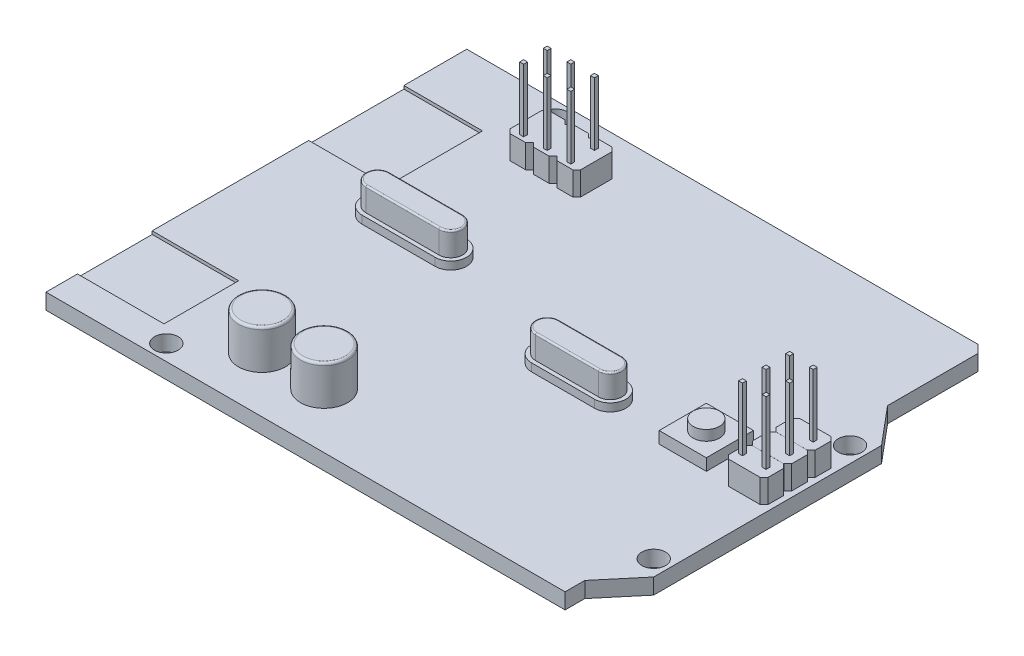
from build123d import *

# Parameters (mm, degrees)
BOSS_EXTRUDE1_DEPTH  = 2
SKETCH2_R            = 1.5
CUT_EXTRUDE1_DEPTH   = 89.126329777
SKETCH3_W            = 11
SKETCH3_H            = 9.5
SKETCH3_W_2          = 10
SKETCH3_H_2          = 12.1
CUT_EXTRUDE3_DEPTH   = 0.4
BOSS_EXTRUDE4_DEPTH  = 3
LPATTERN2_COUNT      = 3
LPATTERN2_PITCH      = 3
SKETCH7_W            = 0.5
SKETCH7_H            = 0.5
BOSS_EXTRUDE6_DEPTH  = 8
LPATTERN3_COUNT      = 3
LPATTERN3_PITCH      = 3
LPATTERN3_COUNT_DIR2 = 2
LPATTERN3_PITCH_DIR2 = 3
BOSS_EXTRUDE8_DEPTH  = 3
LPATTERN4_COUNT      = 3
LPATTERN4_PITCH      = 3
SKETCH10_W           = 0.5
SKETCH10_H           = 0.5
BOSS_EXTRUDE9_DEPTH  = 8
LPATTERN6_COUNT      = 3
LPATTERN6_PITCH      = 3
LPATTERN6_COUNT_DIR2 = 2
LPATTERN6_PITCH_DIR2 = 3
SKETCH11_W           = 6
SKETCH11_H           = 6
BOSS_EXTRUDE10_DEPTH = 1.5
SKETCH12_R           = 1.680467601
BOSS_EXTRUDE11_DEPTH = 1.3
BOSS_EXTRUDE13_DEPTH = 1
BOSS_EXTRUDE14_DEPTH = 3
FILLET1_R            = 0.2
BOSS_EXTRUDE15_DEPTH = 1
BOSS_EXTRUDE16_DEPTH = 3
FILLET2_R            = 0.2
SKETCH29_R           = 3
BOSS_EXTRUDE17_DEPTH = 5
FILLET3_R            = 0.3


with BuildPart() as part:
    # Sketch1 → Boss-Extrude1 (new body)
    with BuildSketch(Plane(origin=(0, 0, 0), x_dir=(1, 0, 0), z_dir=(0, 1, 0))):
        Polygon((0, 0), (0, 53.5), (65, 53.5), (66, 52.5), (66, 41), (70, 36.23298563), (70, 7.26701437), (66, 2.5), (66, 0), align=None)
    extrude(amount=BOSS_EXTRUDE1_DEPTH)

    # Sketch2 → Cut-Extrude1 (cut, through all)
    with BuildSketch(Plane(origin=(0, 2, 0), x_dir=(1, 0, 0), z_dir=(0, 1, 0))):
        with Locations((68, 34.23298563)):
            Circle(SKETCH2_R)
        with Locations((68, 9.26701437)):
            Circle(SKETCH2_R)
        with Locations((13.3, 2)):
            Circle(SKETCH2_R)
        with Locations((13.3, 51.5)):
            Circle(SKETCH2_R)
    extrude(amount=-CUT_EXTRUDE1_DEPTH, mode=Mode.SUBTRACT)

    # Sketch3 → Cut-Extrude3 (cut)
    with BuildSketch(Plane(origin=(0, 2, 0), x_dir=(1, 0, 0), z_dir=(0, 1, 0))):
        with Locations((5.5, 8.75)):
            Rectangle(SKETCH3_W, SKETCH3_H)
        with Locations((5, 39.45)):
            Rectangle(SKETCH3_W_2, SKETCH3_H_2)
    extrude(amount=-CUT_EXTRUDE3_DEPTH, mode=Mode.SUBTRACT)

    # Sketch6 → Boss-Extrude4 (add)
    with BuildSketch(Plane(origin=(0, 2, 0), x_dir=(1, 0, 0), z_dir=(0, 1, 0))):
        Polygon((64.8, 31), (68.8, 31), (69.3, 30.5), (69.3, 28.504777208), (68.8, 28.004777208), (64.8, 28.004777208), (64.3, 28.504777208), (64.3, 30.5), align=None)
    boss_extrude4 = extrude(amount=BOSS_EXTRUDE4_DEPTH)

    # LPattern2: Boss-Extrude4 ×3
    with Locations(*[(0, 0, i * LPATTERN2_PITCH) for i in range(1, LPATTERN2_COUNT)]):
        add(boss_extrude4)

    # Sketch7 → Boss-Extrude6 (add)
    with BuildSketch(Plane(origin=(0, 5, 0), x_dir=(1, 0, 0), z_dir=(0, 1, 0))):
        with Locations((65.05, 29.5)):
            Rectangle(SKETCH7_W, SKETCH7_H)
    boss_extrude6 = extrude(amount=BOSS_EXTRUDE6_DEPTH)

    # LPattern3: Boss-Extrude6 3 × 2
    with Locations(*[(j * LPATTERN3_PITCH_DIR2, 0, i * LPATTERN3_PITCH) for i in range(LPATTERN3_COUNT) for j in range(LPATTERN3_COUNT_DIR2) if (i, j) != (0, 0)]):
        add(boss_extrude6)

    # Sketch9 → Boss-Extrude8 (add)
    with BuildSketch(Plane(origin=(0, 2, 0), x_dir=(1, 0, 0), z_dir=(0, 1, 0))):
        Polygon((14.518797874, 48.458802695), (15.018797874, 48.958802695), (17.018797874, 48.958802695), (17.518797874, 48.458802695), (17.518797874, 44.458802695), (17.018797874, 43.958802695), (15.018797874, 43.958802695), (14.518797874, 44.458802695), align=None)
    boss_extrude8 = extrude(amount=BOSS_EXTRUDE8_DEPTH)

    # LPattern4: Boss-Extrude8 ×3
    with Locations(*[(i * LPATTERN4_PITCH, 0, 0) for i in range(1, LPATTERN4_COUNT)]):
        add(boss_extrude8)

    # Sketch10 → Boss-Extrude9 (add)
    with BuildSketch(Plane(origin=(0, 5, 0), x_dir=(1, 0, 0), z_dir=(0, 1, 0))):
        with Locations((16.018797874, 44.708802695)):
            Rectangle(SKETCH10_W, SKETCH10_H)
    boss_extrude9 = extrude(amount=BOSS_EXTRUDE9_DEPTH)

    # LPattern6: Boss-Extrude9 3 × 2
    with Locations(*[(i * LPATTERN6_PITCH, 0, -j * LPATTERN6_PITCH_DIR2) for i in range(LPATTERN6_COUNT) for j in range(LPATTERN6_COUNT_DIR2) if (i, j) != (0, 0)]):
        add(boss_extrude9)

    # Sketch11 → Boss-Extrude10 (add)
    with BuildSketch(Plane(origin=(0, 2, 0), x_dir=(1, 0, 0), z_dir=(0, 1, 0))):
        with Locations((58.717415981, 25.240731318)):
            Rectangle(SKETCH11_W, SKETCH11_H)
    extrude(amount=BOSS_EXTRUDE10_DEPTH)

    # Sketch12 → Boss-Extrude11 (add)
    with BuildSketch(Plane(origin=(0, 3.5, 0), x_dir=(1, 0, 0), z_dir=(0, 1, 0))):
        with Locations((58.717415981, 25.240731318)):
            Circle(SKETCH12_R)
    extrude(amount=BOSS_EXTRUDE11_DEPTH)

    # Sketch15 → Boss-Extrude13 (add)
    with BuildSketch(Plane(origin=(0, 2, 0), x_dir=(1, 0, 0), z_dir=(0, 1, 0))):
        with BuildLine():
            Line((39.657997107, 26.083421199), (47.657997107, 26.083421199))
            ThreePointArc((47.657997107, 26.083421199), (49.657997107, 24.083421199), (47.657997107, 22.083421199))
            Line((47.657997107, 22.083421199), (39.657997107, 22.083421199))
            ThreePointArc((39.657997107, 22.083421199), (37.657997107, 24.083421199), (39.657997107, 26.083421199))
        make_face()
    extrude(amount=BOSS_EXTRUDE13_DEPTH)

    # Sketch26 → Boss-Extrude14 (add)
    with BuildSketch(Plane(origin=(0, 3, 0), x_dir=(1, 0, 0), z_dir=(0, 1, 0))):
        with BuildLine():
            Line((39.657997107, 25.583421199), (47.657997107, 25.583421199))
            ThreePointArc((47.657997107, 25.583421199), (49.157997107, 24.083421199), (47.657997107, 22.583421199))
            Line((47.657997107, 22.583421199), (39.657997107, 22.583421199))
            ThreePointArc((39.657997107, 22.583421199), (38.157997107, 24.083421199), (39.657997107, 25.583421199))
        make_face()
    extrude(amount=BOSS_EXTRUDE14_DEPTH)

    # Fillet1
    fillet1_edges = [part.edges().sort_by_distance(p)[0] for p in [
        (43.657997107, 6, -25.583421199),
        (49.157997107, 6, -24.083421199),
        (43.657997107, 6, -22.583421199),
        (38.157997107, 6, -24.083421199),
    ]]
    fillet(fillet1_edges, radius=FILLET1_R)

    # Sketch27 → Boss-Extrude15 (add)
    with BuildSketch(Plane(origin=(0, 2, 0), x_dir=(1, 0, 0), z_dir=(0, 1, 0))):
        with BuildLine():
            Line((12.60771505, 31.568908556), (21.900403763, 31.568908556))
            ThreePointArc((21.900403763, 31.568908556), (23.900403763, 29.568908556), (21.900403763, 27.568908556))
            Line((21.900403763, 27.568908556), (12.60771505, 27.568908556))
            ThreePointArc((12.60771505, 27.568908556), (10.60771505, 29.568908556), (12.60771505, 31.568908556))
        make_face()
    extrude(amount=BOSS_EXTRUDE15_DEPTH)

    # Sketch28 → Boss-Extrude16 (add)
    with BuildSketch(Plane(origin=(0, 3, 0), x_dir=(1, 0, 0), z_dir=(0, 1, 0))):
        with BuildLine():
            Line((12.60771505, 31.068908556), (21.900403763, 31.068908556))
            ThreePointArc((21.900403763, 31.068908556), (23.400403763, 29.568908556), (21.900403763, 28.068908556))
            Line((21.900403763, 28.068908556), (12.60771505, 28.068908556))
            ThreePointArc((12.60771505, 28.068908556), (11.10771505, 29.568908556), (12.60771505, 31.068908556))
        make_face()
    extrude(amount=BOSS_EXTRUDE16_DEPTH)

    # Fillet2
    fillet2_edges = [part.edges().sort_by_distance(p)[0] for p in [
        (17.254059406, 6, -31.068908556),
        (23.400403763, 6, -29.568908556),
        (17.254059406, 6, -28.068908556),
        (11.10771505, 6, -29.568908556),
    ]]
    fillet(fillet2_edges, radius=FILLET2_R)

    # Sketch29 → Boss-Extrude17 (add)
    with BuildSketch(Plane(origin=(0, 2, 0), x_dir=(1, 0, 0), z_dir=(0, 1, 0))):
        with Locations((20.457491656, 7)):
            Circle(SKETCH29_R)
        with Locations((28.357680745, 7)):
            Circle(SKETCH29_R)
    extrude(amount=BOSS_EXTRUDE17_DEPTH)

    # Fillet3
    fillet3_edges = [part.edges().sort_by_distance(p)[0] for p in [
        (17.457491656, 7, -7),
        (25.357680745, 7, -7),
    ]]
    fillet(fillet3_edges, radius=FILLET3_R)


solid = part.part
